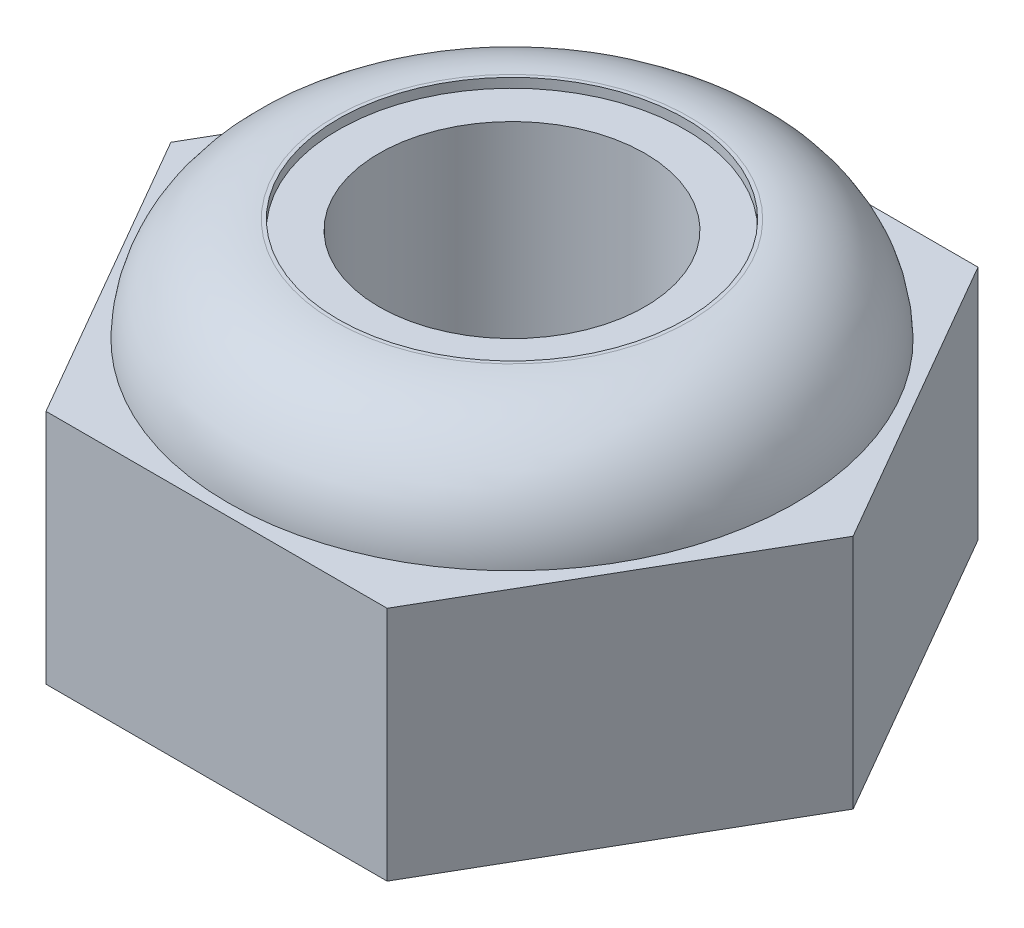
from build123d import *

# Parameters (mm, degrees)
BOSS_EXTRUDE1_DEPTH = 2.54
SKETCH2_R           = 3.048
SKETCH2_R_2         = 1.8669
BOSS_EXTRUDE2_DEPTH = 1.1176
FILLET1_R           = 1.143
SKETCH3_R           = 1.8669
SKETCH3_R_2         = 1.42875
BOSS_EXTRUDE3_DEPTH = 1.016
SKETCH4_R           = 1.42875
CUT_EXTRUDE1_DEPTH  = 6.474765596


with BuildPart() as part:
    # Sketch1 → Boss-Extrude1 (new body)
    with BuildSketch(Plane(origin=(0, 0, 0), x_dir=(1, 0, 0), z_dir=(0, 1, 0))):
        Polygon((3.666174209, 0), (1.833087105, 3.175), (-1.833087105, 3.175), (-3.666174209, 0), (-1.833087105, -3.175), (1.833087105, -3.175), align=None)
    extrude(amount=BOSS_EXTRUDE1_DEPTH)

    # Sketch2 → Boss-Extrude2 (add)
    with BuildSketch(Plane(origin=(0, 2.54, 0), x_dir=(1, 0, 0), z_dir=(0, 1, 0))):
        with Locations(Location((0, 0, 0), (0, 0, 270))):
            Circle(SKETCH2_R)
        with Locations(Location((0, 0, 0), (0, 0, 270))):
            Circle(SKETCH2_R_2, mode=Mode.SUBTRACT)
    extrude(amount=BOSS_EXTRUDE2_DEPTH)

    # Fillet1
    # the kernel refuses this fillet: 1.143 mm, written as the material it takes off along each edge
    with BuildSketch(Plane(origin=(0, 3.6576, 0), x_dir=(0, 0, 1), z_dir=(-1, 0, 0))) as fillet1_piece_1_section:
        with BuildLine():
            CenterArc((3.048 - FILLET1_R, -FILLET1_R), FILLET1_R, 0, 90)
            Line((3.048 - FILLET1_R, 0), (3.048, 0))
            Line((3.048, 0), (3.048, -FILLET1_R))
        make_face()
    fillet1_piece_1 = revolve(axis=Axis((0, 3.6576, 0), (0, 1, 0)), mode=Mode.PRIVATE)
    fillet1_piece_1 = split(fillet1_piece_1, bisect_by=Plane(origin=(0, 2.54, -2.716774649), z_dir=(0, 1, 0)), keep=Keep.TOP, mode=Mode.PRIVATE)
    add(fillet1_piece_1, mode=Mode.SUBTRACT)

    # Sketch3 → Boss-Extrude3 (add)
    with BuildSketch(Plane(origin=(0, 2.54, 0), x_dir=(1, 0, 0), z_dir=(0, 1, 0))):
        with Locations(Location((0, 0, 0), (0, 0, 270))):
            Circle(SKETCH3_R)
        with Locations(Location((0, 0, 0), (0, 0, 270))):
            Circle(SKETCH3_R_2, mode=Mode.SUBTRACT)
    extrude(amount=BOSS_EXTRUDE3_DEPTH)

    # Sketch4 → Cut-Extrude1 (cut, through all)
    with BuildSketch(Plane(origin=(0, 2.54, 0), x_dir=(1, 0, 0), z_dir=(0, 1, 0))):
        with Locations(Location((0, 0, 0), (0, 0, 270))):
            Circle(SKETCH4_R)
    extrude(amount=-CUT_EXTRUDE1_DEPTH, mode=Mode.SUBTRACT)


solid = part.part
